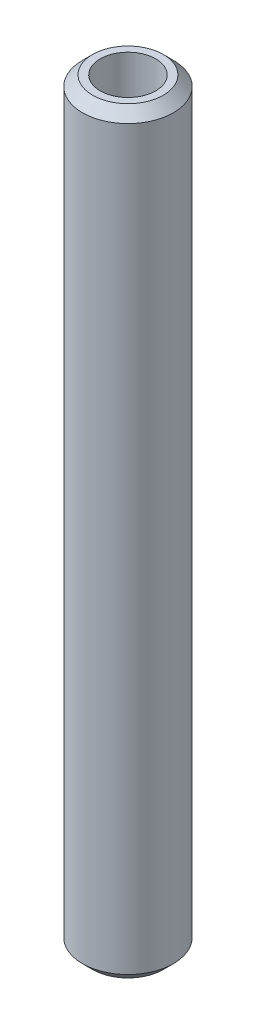
from build123d import *

# Parameters (mm, degrees)
SKETCH1_R           = 12.5
BOSS_EXTRUDE1_DEPTH = 208.251954601
SKETCH2_R           = 7.638945985
CUT_EXTRUDE1_DEPTH  = 210.000900943
CHAMFER1_SIZE       = 2.782226947


with BuildPart() as part:
    # Sketch1 → Boss-Extrude1 (new body)
    with BuildSketch(Plane(origin=(0, 0, 0), x_dir=(1, 0, 0), z_dir=(0, 1, 0))):
        Circle(SKETCH1_R)
    extrude(amount=BOSS_EXTRUDE1_DEPTH)

    # Sketch2 → Cut-Extrude1 (cut, through all)
    with BuildSketch(Plane(origin=(0, 0, 0), x_dir=(1, 0, 0), z_dir=(0, 1, 0))):
        Circle(SKETCH2_R)
    extrude(amount=CUT_EXTRUDE1_DEPTH, mode=Mode.SUBTRACT)

    # Chamfer1
    chamfer1_edges = [part.edges().sort_by_distance(p)[0] for p in [
        (-12.5, 208.251954601, 0),
        (-12.5, 0, 0),
    ]]
    chamfer(chamfer1_edges, length=CHAMFER1_SIZE)


solid = part.part
